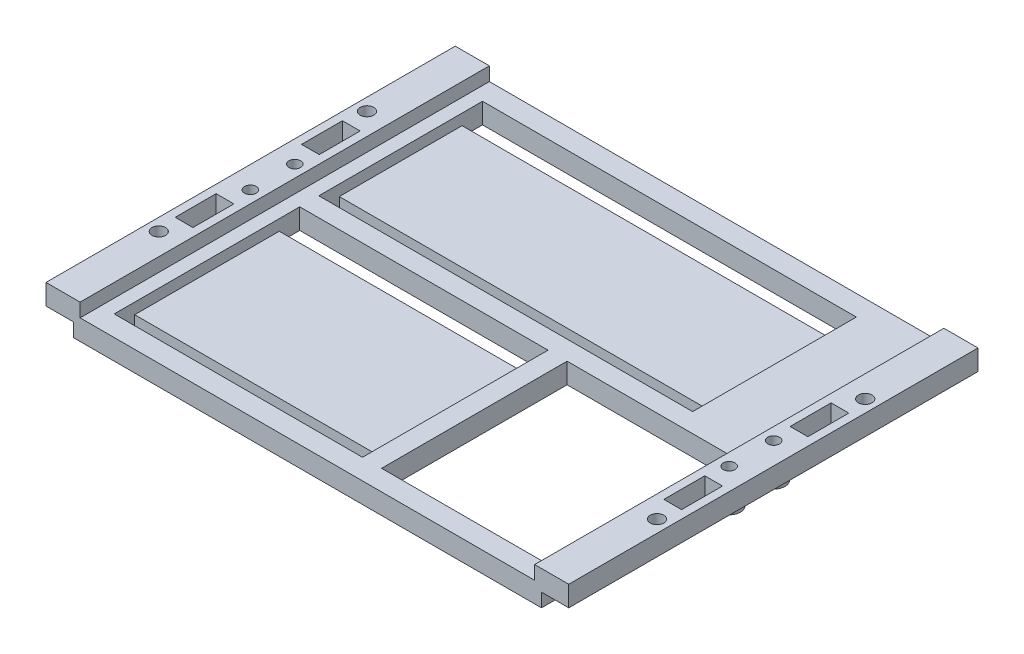
from build123d import *

# Parameters (mm, degrees)
PLATEFRAME_DEPTH          = 150
SKETCH3_R                 = 2.5
HOLESUPPORT_DEPTH         = 244.653052515
SKETCH4_R                 = 4.15
SKETCH4_R_2               = 2.15
CYLINDRICALSUPPORTS_DEPTH = 12.5
SKETCH8_W                 = 137
SKETCH8_H                 = 60
SKETCH8_W_2               = 91
SKETCH8_H_2               = 68
ITEMLAYOUT_DEPTH          = 4
SKETCH9_W                 = 58.6
SKETCH9_H                 = 68
HOLECUTOUT_DEPTH          = 7.5
SKETCH10_W                = 91
SKETCH10_H                = 7.5
SKETCH10_W_2              = 137
VELCROCUT_DEPTH           = 3.5
SKETCH11_W                = 6.5
SKETCH11_H                = 15
CUTSHELLHOLES_DEPTH       = 12.5
SKETCH12_R                = 2.5
STANDOFFHOLES_DEPTH       = 244.653052515
SKETCH13_W                = 2.5
SKETCH13_H                = 41
CUTSTANDOFFROOM_DEPTH     = 5


with BuildPart() as part:
    # Sketch2 → PlateFrame (new body)
    with BuildSketch(Plane.XY):
        Polygon((179.1, 12.5), (191.6, 12.5), (191.6, 5), (184.1, 5), (184.1, 0), (7.5, 0), (7.5, 5), (0, 5), (0, 12.5), (12.5, 12.5), (12.5, 7.5), (179.1, 7.5), align=None)
    extrude(amount=PLATEFRAME_DEPTH)

    # Sketch3 → HoleSupport (cut, through all)
    with BuildSketch(Plane(origin=(0, 12.5, 0), x_dir=(1, 0, 0), z_dir=(0, 1, 0))):
        with Locations((8.05, -66.85)):
            Circle(SKETCH3_R)
        with Locations((8.05, -83.15)):
            Circle(SKETCH3_R)
        with Locations((183.55, -66.85)):
            Circle(SKETCH3_R)
        with Locations((183.55, -83.15)):
            Circle(SKETCH3_R)
    extrude(amount=-HOLESUPPORT_DEPTH, mode=Mode.SUBTRACT)

    # Sketch4 → CylindricalSupports (add)
    # profile 1 of 4: a face of its own
    with BuildSketch(Plane(origin=(0, 12.5, 0), x_dir=(1, 0, 0), z_dir=(0, 1, 0))):
        with Locations((183.55, -66.85)):
            Circle(SKETCH4_R)
        with Locations((183.55, -66.85)):
            Circle(SKETCH4_R_2, mode=Mode.SUBTRACT)
    # profile 2 of 4: a face of its own
    with BuildSketch(Plane(origin=(0, 12.5, 0), x_dir=(1, 0, 0), z_dir=(0, 1, 0))):
        with Locations((183.55, -83.15)):
            Circle(SKETCH4_R)
        with Locations((183.55, -83.15)):
            Circle(SKETCH4_R_2, mode=Mode.SUBTRACT)
    # profile 3 of 4: a face of its own
    with BuildSketch(Plane(origin=(0, 12.5, 0), x_dir=(1, 0, 0), z_dir=(0, 1, 0))):
        with Locations((8.05, -66.85)):
            Circle(SKETCH4_R)
        with Locations((8.05, -66.85)):
            Circle(SKETCH4_R_2, mode=Mode.SUBTRACT)
    # profile 4 of 4: a face of its own
    with BuildSketch(Plane(origin=(0, 12.5, 0), x_dir=(1, 0, 0), z_dir=(0, 1, 0))):
        with Locations((8.05, -83.15)):
            Circle(SKETCH4_R)
        with Locations((8.05, -83.15)):
            Circle(SKETCH4_R_2, mode=Mode.SUBTRACT)
    extrude(amount=-CYLINDRICALSUPPORTS_DEPTH)

    # Sketch8 → ItemLayout (cut)
    with BuildSketch(Plane(origin=(0, 7.5, 0), x_dir=(1, 0, 0), z_dir=(0, 1, 0))):
        with Locations((86, -37.5)):
            Rectangle(SKETCH8_W, SKETCH8_H)
        with Locations((63, -108.5)):
            Rectangle(SKETCH8_W_2, SKETCH8_H_2)
    extrude(amount=-ITEMLAYOUT_DEPTH, mode=Mode.SUBTRACT)

    # Sketch9 → HoleCutout (cut)
    with BuildSketch(Plane(origin=(0, 7.5, 0), x_dir=(1, 0, 0), z_dir=(0, 1, 0))):
        with Locations((144.8, -108.5)):
            Rectangle(SKETCH9_W, SKETCH9_H)
    extrude(amount=-HOLECUTOUT_DEPTH, mode=Mode.SUBTRACT)

    # Sketch10 → VelcroCut (cut)
    with BuildSketch(Plane(origin=(0, 3.5, 0), x_dir=(1, 0, 0), z_dir=(0, 1, 0))):
        with Locations((63, -78.25)):
            Rectangle(SKETCH10_W, SKETCH10_H)
        with Locations((63, -138.75)):
            Rectangle(SKETCH10_W, SKETCH10_H)
        with Locations((86, -11.25)):
            Rectangle(SKETCH10_W_2, SKETCH10_H)
        with Locations((86, -63.75)):
            Rectangle(SKETCH10_W_2, SKETCH10_H)
    extrude(amount=-VELCROCUT_DEPTH, mode=Mode.SUBTRACT)

    # Sketch11 → CutShellHoles (cut)
    with BuildSketch(Plane(origin=(0, 12.5, 0), x_dir=(1, 0, 0), z_dir=(0, 1, 0))):
        with Locations((6.25, -51.85)):
            Rectangle(SKETCH11_W, SKETCH11_H)
        with Locations((185.35, -51.85)):
            Rectangle(SKETCH11_W, SKETCH11_H)
        with Locations((185.35, -98.15)):
            Rectangle(SKETCH11_W, SKETCH11_H)
        with Locations((6.25, -98.15)):
            Rectangle(SKETCH11_W, SKETCH11_H)
    extrude(amount=-CUTSHELLHOLES_DEPTH, mode=Mode.SUBTRACT)

    # Sketch12 → StandoffHoles (cut, through all)
    with BuildSketch(Plane(origin=(0, 12.5, 0), x_dir=(1, 0, 0), z_dir=(0, 1, 0))):
        with Locations((4.5, -36.85)):
            Circle(SKETCH12_R)
        with Locations((4.5, -113.15)):
            Circle(SKETCH12_R)
        with Locations((187.1, -36.85)):
            Circle(SKETCH12_R)
        with Locations((187.1, -113.15)):
            Circle(SKETCH12_R)
    extrude(amount=-STANDOFFHOLES_DEPTH, mode=Mode.SUBTRACT)

    # Sketch13 → CutStandoffRoom (cut)
    with BuildSketch(Plane.XZ):
        with Locations((8.75, 20.5)):
            Rectangle(SKETCH13_W, SKETCH13_H)
        with Locations((8.75, 129.5)):
            Rectangle(SKETCH13_W, SKETCH13_H)
        with Locations((182.85, 129.5)):
            Rectangle(SKETCH13_W, SKETCH13_H)
        with Locations((182.85, 20.5)):
            Rectangle(SKETCH13_W, SKETCH13_H)
    extrude(amount=-CUTSTANDOFFROOM_DEPTH, mode=Mode.SUBTRACT)


solid = part.part
